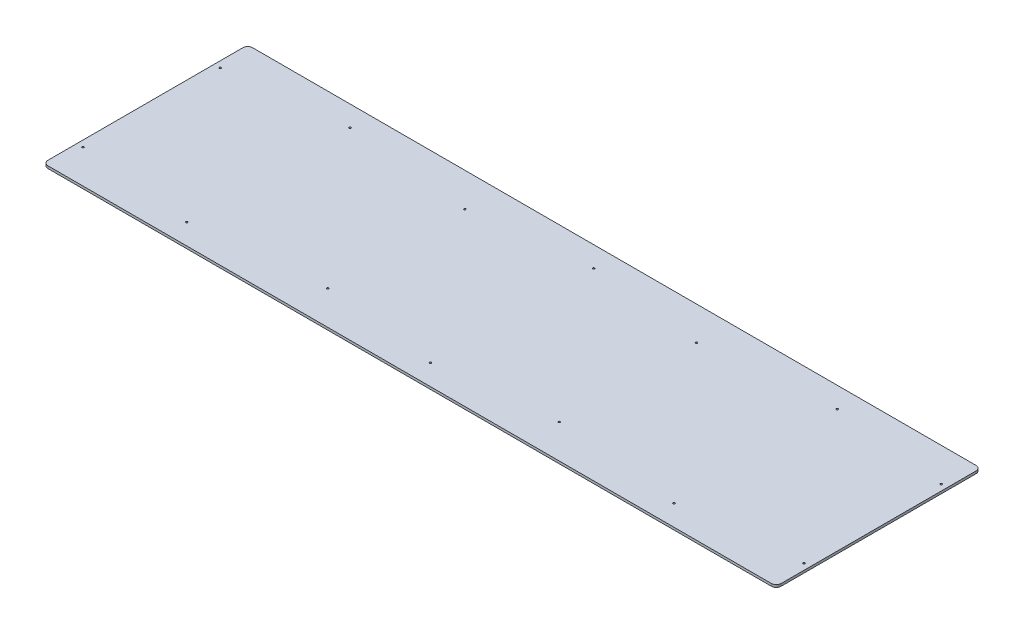
from build123d import *

# Parameters (mm, degrees)
SKETCH1_W           = 1911.35
SKETCH1_H           = 533.4
BOSS_EXTRUDE1_DEPTH = 6.35
FILLET1_R           = 12.7
SKETCH2_R           = 2.4511
CUT_EXTRUDE1_DEPTH  = 6.35
SKETCH7_R           = 2.4511
CUT_EXTRUDE2_DEPTH  = 6.35


with BuildPart() as part:
    # Sketch1 → Boss-Extrude1 (new body)
    with BuildSketch(Plane(origin=(0, 0, 0), x_dir=(1, 0, 0), z_dir=(0, 1, 0))):
        with Locations((955.675, 266.7)):
            Rectangle(SKETCH1_W, SKETCH1_H)
    extrude(amount=BOSS_EXTRUDE1_DEPTH)

    # Fillet1
    fillet1_edges = [part.edges().sort_by_distance(p)[0] for p in [
        (1911.35, 3.175, 0),
        (1911.35, 3.175, -533.4),
        (0, 3.175, 0),
        (0, 3.175, -533.4),
    ]]
    fillet(fillet1_edges, radius=FILLET1_R)

    # Sketch2 → Cut-Extrude1 (cut)
    with BuildSketch(Plane(origin=(0, 6.35, 0), x_dir=(1, 0, 0), z_dir=(0, 1, 0))):
        with Locations((15.875, 445.643)):
            Circle(SKETCH2_R)
        with Locations((653.965333418, 445.643)):
            Circle(SKETCH2_R)
        with Locations((653.965333418, 88.011)):
            Circle(SKETCH2_R)
        with Locations((15.875, 88.011)):
            Circle(SKETCH2_R)
        with Locations((1257.384666582, 445.643)):
            Circle(SKETCH2_R)
        with Locations((1257.384666582, 88.011)):
            Circle(SKETCH2_R)
        with Locations((1895.475, 445.643)):
            Circle(SKETCH2_R)
        with Locations((1895.475, 88.011)):
            Circle(SKETCH2_R)
    extrude(amount=-CUT_EXTRUDE1_DEPTH, mode=Mode.SUBTRACT)

    # Sketch7 → Cut-Extrude2 (cut)
    with BuildSketch(Plane(origin=(0, 6.35, 0), x_dir=(1, 0, 0), z_dir=(0, 1, 0))):
        with Locations((320.675, 479.425)):
            Circle(SKETCH7_R)
        with Locations((320.675, 53.975)):
            Circle(SKETCH7_R)
        with Locations((955.675, 53.975)):
            Circle(SKETCH7_R)
        with Locations((955.675, 479.425)):
            Circle(SKETCH7_R)
        with Locations((1590.675, 479.425)):
            Circle(SKETCH7_R)
        with Locations((1590.675, 53.975)):
            Circle(SKETCH7_R)
    extrude(amount=-CUT_EXTRUDE2_DEPTH, mode=Mode.SUBTRACT)


solid = part.part
